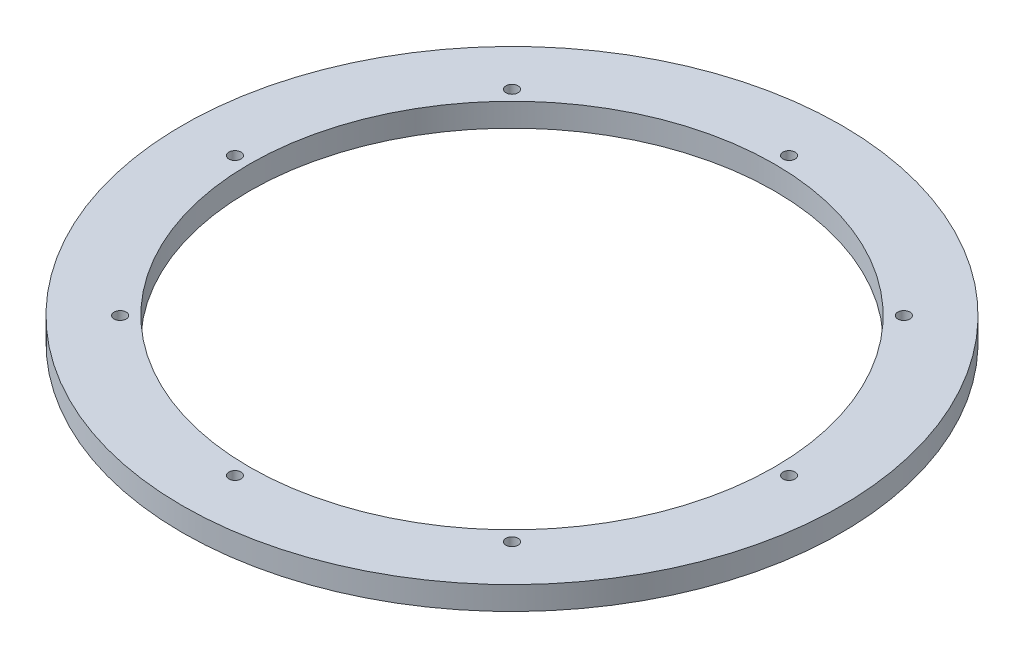
from build123d import *

# Parameters (mm, degrees)
SKETCH1_R           = 71.755
SKETCH1_R_2         = 1.3208
SKETCH1_R_3         = 57.15
BOSS_EXTRUDE1_DEPTH = 5.08


with BuildPart() as part:
    # Sketch1 → Boss-Extrude1 (new body)
    with BuildSketch(Plane(origin=(0, 0, 0), x_dir=(1, 0, 0), z_dir=(0, 1, 0))):
        Circle(SKETCH1_R)
        with Locations((42.656216575, 42.656216575)):
            Circle(SKETCH1_R_2, mode=Mode.SUBTRACT)
        with Locations((-42.656216575, -42.656216575)):
            Circle(SKETCH1_R_2, mode=Mode.SUBTRACT)
        with Locations((0, -60.325)):
            Circle(SKETCH1_R_2, mode=Mode.SUBTRACT)
        with Locations((42.656216575, -42.656216575)):
            Circle(SKETCH1_R_2, mode=Mode.SUBTRACT)
        with Locations((-60.325, 0)):
            Circle(SKETCH1_R_2, mode=Mode.SUBTRACT)
        with Locations((-42.656216575, 42.656216575)):
            Circle(SKETCH1_R_2, mode=Mode.SUBTRACT)
        Circle(SKETCH1_R_3, mode=Mode.SUBTRACT)
        with Locations((60.325, 0)):
            Circle(SKETCH1_R_2, mode=Mode.SUBTRACT)
        with Locations((0, 60.325)):
            Circle(SKETCH1_R_2, mode=Mode.SUBTRACT)
    extrude(amount=BOSS_EXTRUDE1_DEPTH)


solid = part.part
